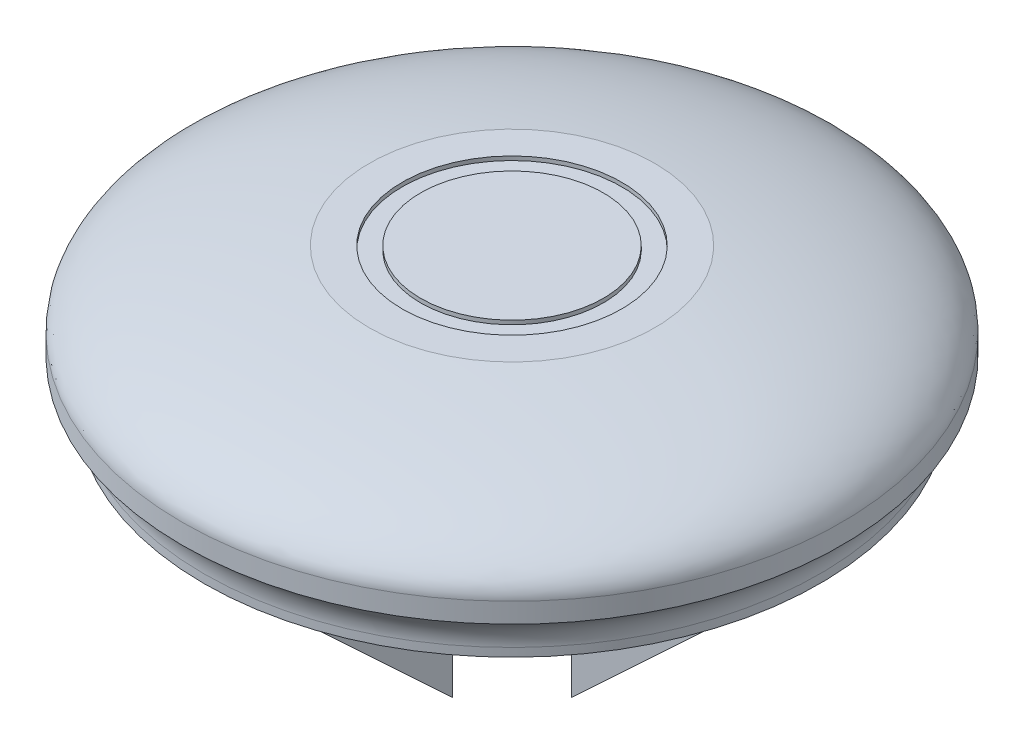
from build123d import *

# Parameters (mm, degrees)
SKETCH1_R           = 82.832169861
BOSS_EXTRUDE1_DEPTH = 5
SKETCH3_W           = 93.167206873
SKETCH3_H           = 4.120105984
CUT_EXTRUDE1_DEPTH  = 75
SKETCH4_R           = 27.598349682
SKETCH4_R_2         = 22.972927947
CUT_EXTRUDE2_DEPTH  = 1
BOSS_EXTRUDE2_START = 11
SKETCH5_R           = 77.433591729
BOSS_EXTRUDE2_DEPTH = 11
FILLET1_R           = 10
SKETCH6_W           = 49.330343736
SKETCH6_H           = 20
BOSS_EXTRUDE3_DEPTH = 46
CUT_EXTRUDE3_DEPTH  = 46
CIRPATTERN1_COUNT   = 4


with BuildPart() as part:
    # Sketch1 → Boss-Extrude1 (new body)
    with BuildSketch(Plane(origin=(0, 0, 0), x_dir=(1, 0, 0), z_dir=(0, 1, 0))):
        with Locations(Location((-49.943747887, -23.441982102, 0), (0, 0, 270))):
            Circle(SKETCH1_R)
        with BuildLine():
            Line((-59.943747887, 50.888361635), (-59.943747887, 1.558017898))
            Line((-59.943747887, 1.558017898), (-39.943747887, 1.558017898))
            Line((-39.943747887, 1.558017898), (-39.943747887, 50.888361635))
            ThreePointArc((-39.943747887, 50.888361635), (3.089260702, 29.591026487), (24.386595849, -13.441982102))
            Line((24.386595849, -13.441982102), (-24.943747887, -13.441982102))
            Line((-24.943747887, -13.441982102), (-24.943747887, -33.441982102))
            Line((-24.943747887, -33.441982102), (24.386595849, -33.441982102))
            ThreePointArc((24.386595849, -33.441982102), (3.089260702, -76.474990691), (-39.943747887, -97.772325838))
            Line((-39.943747887, -97.772325838), (-39.943747887, -48.441982102))
            Line((-39.943747887, -48.441982102), (-59.943747887, -48.441982102))
            Line((-59.943747887, -48.441982102), (-59.943747887, -97.772325838))
            ThreePointArc((-59.943747887, -97.772325838), (-102.976756476, -76.474990691), (-124.274091624, -33.441982102))
            Line((-124.274091624, -33.441982102), (-74.943747887, -33.441982102))
            Line((-74.943747887, -33.441982102), (-74.943747887, -13.441982102))
            Line((-74.943747887, -13.441982102), (-124.274091624, -13.441982102))
            ThreePointArc((-124.274091624, -13.441982102), (-102.976756476, 29.591026487), (-59.943747887, 50.888361635))
        make_face(mode=Mode.SUBTRACT)
    extrude(amount=BOSS_EXTRUDE1_DEPTH)

    # Sketch2 → Revolve1 (revolve)
    with BuildSketch(Plane.XY.offset(23.441982102)):
        with BuildLine():
            Line((-49.943747887, 5), (-49.943747887, 25.910941369))
            add(Edge.make_bspline(
                [(32.888421974, 5), (32.888421974, 25.910941369), (-49.943747887, 25.910941369)],
                knots=[0, 0, 0, 1.570796327, 1.570796327, 1.570796327], degree=2, weights=[1, 0.707106781, 1]))
            Line((32.888421974, 5), (-49.943747887, 5))
        make_face()
    revolve(axis=Axis((-49.943747887, 5, 23.441982102), (0, 1, 0)))

    # Sketch3 → Cut-Extrude1 (cut, symmetric)
    with BuildSketch(Plane.XY.offset(23.441982102)):
        with Locations((-49.943747888, 25.910941369)):
            Rectangle(SKETCH3_W, SKETCH3_H)
    extrude(amount=CUT_EXTRUDE1_DEPTH, both=True, mode=Mode.SUBTRACT)

    # Sketch4 → Cut-Extrude2 (cut)
    with BuildSketch(Plane(origin=(0, 23.850888377, 0), x_dir=(1, 0, 0), z_dir=(0, 1, 0))):
        with Locations(Location((-49.943747887, -23.441982102, 0), (0, 0, 270))):
            Circle(SKETCH4_R)
        with Locations(Location((-49.943747887, -23.441982102, 0), (0, 0, 270))):
            Circle(SKETCH4_R_2, mode=Mode.SUBTRACT)
    extrude(amount=-CUT_EXTRUDE2_DEPTH, mode=Mode.SUBTRACT)

    # Sketch5 → Boss-Extrude2 (add)
    with BuildSketch(Plane.XZ.offset(BOSS_EXTRUDE2_START)):
        with Locations(Location((-49.943747887, 23.441982102, 0), (0, 0, 90))):
            Circle(SKETCH5_R)
        with BuildLine():
            Line((-59.943747887, 97.772325838), (-59.943747887, 48.441982102))
            Line((-59.943747887, 48.441982102), (-39.943747887, 48.441982102))
            Line((-39.943747887, 48.441982102), (-39.943747887, 97.772325838))
            ThreePointArc((-39.943747887, 97.772325838), (3.089260702, 76.474990691), (24.386595849, 33.441982102))
            Line((24.386595849, 33.441982102), (-24.943747887, 33.441982102))
            Line((-24.943747887, 33.441982102), (-24.943747887, 13.441982102))
            Line((-24.943747887, 13.441982102), (24.386595849, 13.441982102))
            ThreePointArc((24.386595849, 13.441982102), (3.089260702, -29.591026487), (-39.943747887, -50.888361635))
            Line((-39.943747887, -50.888361635), (-39.943747887, -1.558017898))
            Line((-39.943747887, -1.558017898), (-59.943747887, -1.558017898))
            Line((-59.943747887, -1.558017898), (-59.943747887, -50.888361635))
            ThreePointArc((-59.943747887, -50.888361635), (-102.976756476, -29.591026487), (-124.274091624, 13.441982102))
            Line((-124.274091624, 13.441982102), (-74.943747887, 13.441982102))
            Line((-74.943747887, 13.441982102), (-74.943747887, 33.441982102))
            Line((-74.943747887, 33.441982102), (-124.274091624, 33.441982102))
            ThreePointArc((-124.274091624, 33.441982102), (-102.976756476, 76.474990691), (-59.943747887, 97.772325838))
        make_face(mode=Mode.SUBTRACT)
    extrude(amount=-BOSS_EXTRUDE2_DEPTH)

    # Fillet1
    # the kernel refuses this fillet: 10 mm, written as the material it adds along each edge
    with BuildSketch(Plane(origin=(-49.943747887, 0, 23.441982102), x_dir=(0, 0, 1), z_dir=(1, 0, 0))) as fillet1_piece_1:
        with BuildLine():
            CenterArc((87.433591729, 8.878452387), FILLET1_R, 180, 62.603717063)
            Line((77.433591729, 8.878452387), (77.233591729, 8.878452387))
            Line((77.233591729, 8.878452387), (77.233591729, 0))
            Line((77.233591729, 0), (77.433591729, -0.2))
            ThreePointArc((77.433591729, -0.2), (80.132880795, -0.2), (82.740141424, -0.177569048))
            Line((82.740141424, -0.177569048), (82.832169861, 0))
        make_face()
    revolve(axis=Axis((-49.943747887, 0, 23.441982102), (0, -1, 0)))

    # Sketch6 → Boss-Extrude3 (add)
    with BuildSketch(Plane.XZ.offset(11)):
        with Locations((-0.278576019, 23.441982102)):
            Rectangle(SKETCH6_W, SKETCH6_H)
    boss_extrude3 = extrude(amount=BOSS_EXTRUDE3_DEPTH)

    # Sketch7 → Cut-Extrude3 (cut)
    with BuildSketch(Plane.XY.offset(33.441982102)):
        Polygon((24.386595849, -11), (-24.943747887, -57), (24.386595849, -57), align=None)
    cut_extrude3 = extrude(amount=-CUT_EXTRUDE3_DEPTH, mode=Mode.SUBTRACT)

    # CirPattern1: Boss-Extrude3, Cut-Extrude3 ×4 about axis
    cirpattern1_axis = Axis((-49.943747887, 0, 23.441982102), (0, 1, 0))
    add([boss_extrude3.rotate(cirpattern1_axis, i * 360 / CIRPATTERN1_COUNT) for i in range(1, CIRPATTERN1_COUNT)])
    add([cut_extrude3.rotate(cirpattern1_axis, i * 360 / CIRPATTERN1_COUNT) for i in range(1, CIRPATTERN1_COUNT)], mode=Mode.SUBTRACT)


solid = part.part
